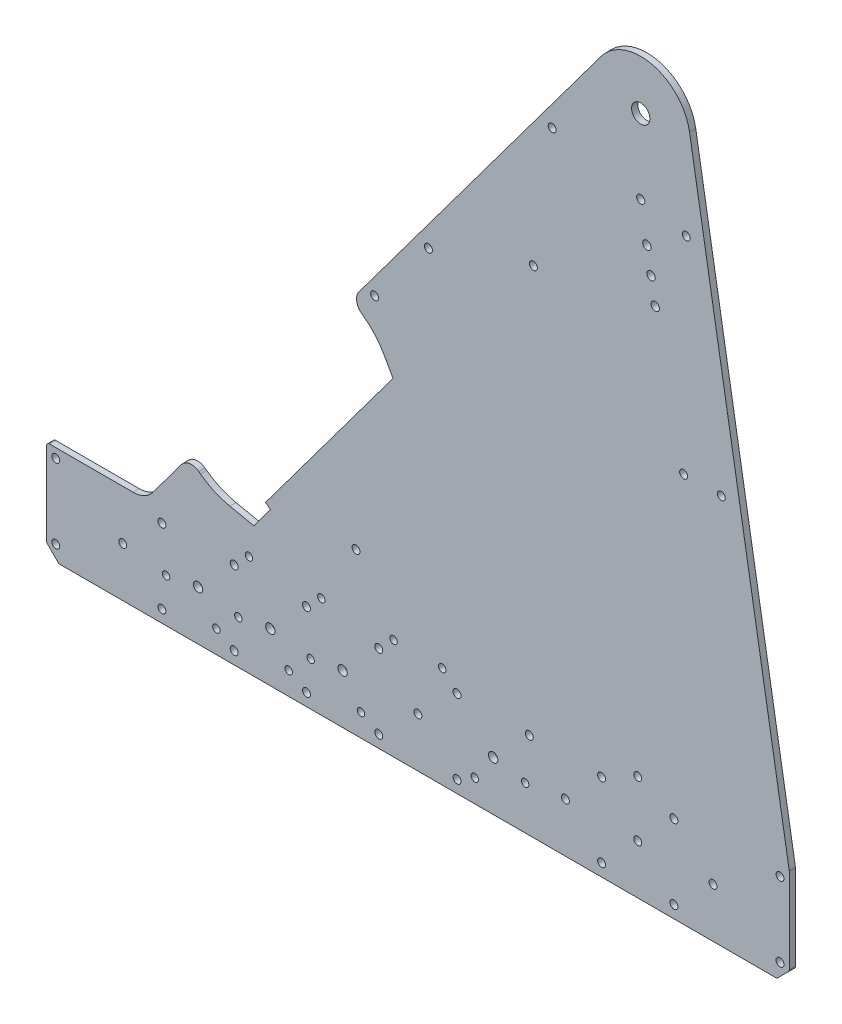
from build123d import *

# Parameters (mm, degrees)
BOSS_EXTRUDE1_DEPTH = 3.175
CUT_EXTRUDE1_REACH  = 536.354
SKETCH2_R           = 2.032
SKETCH5_R           = 2.032
SKETCH5_R_2         = 2.38125
CUT_EXTRUDE4_DEPTH  = 535.353537581
SKETCH6_R           = 2.032
CUT_EXTRUDE5_DEPTH  = 535.353537581
SKETCH3_R           = 4.699
SKETCH3_R_2         = 2.032
SKETCH3_R_3         = 2.0955
SKETCH3_R_4         = 2.159
CUT_EXTRUDE2_DEPTH  = 535.353537581
FILLET1_R           = 1.5875
CUT_EXTRUDE3_REACH  = 536.354
SKETCH4_R           = 1.905
FILLET2_R           = 38.1
FILLET3_R           = 6.35


with BuildPart() as part:
    # Sketch1 → Boss-Extrude1 (new body)
    with BuildSketch(Plane.XY):
        with BuildLine():
            Line((0, 0), (381, 0))
            Line((381, 0), (381, 50.8))
            Line((381, 50.8), (329.844840527, 353.482725241))
            ThreePointArc((329.844840527, 353.482725241), (310.749161823, 373.943470262), (284.430621647, 364.423939024))
            Line((284.430621647, 364.423939024), (156.481664632, 192.666249))
            Line((156.481664632, 192.666249), (169.212526103, 183.18253711))
            Line((169.212526103, 183.18253711), (177.742147454, 168.059112986))
            Line((177.742147454, 168.059112986), (112.328856621, 80.248817439))
            Line((112.328856621, 80.248817439), (114.875028915, 78.352075061))
            Line((114.875028915, 78.352075061), (106.339688214, 66.894299738))
            Line((106.339688214, 66.894299738), (85.755861471, 71.150956167))
            Line((85.755861471, 71.150956167), (73.025, 80.634668057))
            Line((73.025, 80.634668057), (54.608894484, 55.913030488))
            ThreePointArc((54.608894484, 55.913030488), (50.122252657, 52.150010731), (44.424205307, 50.8))
            Line((44.424205307, 50.8), (0, 50.8))
            Line((0, 50.8), (0, 0))
        make_face()
    extrude(amount=BOSS_EXTRUDE1_DEPTH)

    # Sketch2 → Cut-Extrude1 (cut, up to next)
    with BuildSketch(Plane.XY.offset(3.175), mode=Mode.PRIVATE) as cut_extrude1_sk1:
        with Locations((4.7625, 46.0375)):
            Circle(SKETCH2_R)
    cut_extrude1_tool1 = extrude(cut_extrude1_sk1.sketch, amount=-CUT_EXTRUDE1_REACH, mode=Mode.PRIVATE) & part.part
    # Sketch2 → Cut-Extrude1 (cut, up to next)
    with BuildSketch(Plane.XY.offset(3.175), mode=Mode.PRIVATE) as cut_extrude1_sk2:
        with Locations((4.7625, 7.9375)):
            Circle(SKETCH2_R)
    cut_extrude1_tool2 = extrude(cut_extrude1_sk2.sketch, amount=-CUT_EXTRUDE1_REACH, mode=Mode.PRIVATE) & part.part
    # Sketch2 → Cut-Extrude1 (cut, up to next)
    with BuildSketch(Plane.XY.offset(3.175), mode=Mode.PRIVATE) as cut_extrude1_sk3:
        with Locations((376.2375, 7.9375)):
            Circle(SKETCH2_R)
    cut_extrude1_tool3 = extrude(cut_extrude1_sk3.sketch, amount=-CUT_EXTRUDE1_REACH, mode=Mode.PRIVATE) & part.part
    # Sketch2 → Cut-Extrude1 (cut, up to next)
    with BuildSketch(Plane.XY.offset(3.175), mode=Mode.PRIVATE) as cut_extrude1_sk4:
        with Locations((376.2375, 46.0375)):
            Circle(SKETCH2_R)
    cut_extrude1_tool4 = extrude(cut_extrude1_sk4.sketch, amount=-CUT_EXTRUDE1_REACH, mode=Mode.PRIVATE) & part.part
    # Sketch2 → Cut-Extrude1 (cut, up to next)
    with BuildSketch(Plane.XY.offset(3.175), mode=Mode.PRIVATE) as cut_extrude1_sk5:
        Polygon((0, 6.35), (0, 0), (6.35, 0), align=None)
    cut_extrude1_tool5 = extrude(cut_extrude1_sk5.sketch, amount=-CUT_EXTRUDE1_REACH, mode=Mode.PRIVATE) & part.part
    # Sketch2 → Cut-Extrude1 (cut, up to next)
    with BuildSketch(Plane.XY.offset(3.175), mode=Mode.PRIVATE) as cut_extrude1_sk6:
        Polygon((381, 0), (374.65, 0), (381, 6.35), align=None)
    cut_extrude1_tool6 = extrude(cut_extrude1_sk6.sketch, amount=-CUT_EXTRUDE1_REACH, mode=Mode.PRIVATE) & part.part
    add(cut_extrude1_tool1.solids().sort_by_distance((4.7625, 46.0375, 3.175))[0], mode=Mode.SUBTRACT)
    add(cut_extrude1_tool2.solids().sort_by_distance((4.7625, 7.9375, 3.175))[0], mode=Mode.SUBTRACT)
    add(cut_extrude1_tool3.solids().sort_by_distance((376.2375, 7.9375, 3.175))[0], mode=Mode.SUBTRACT)
    add(cut_extrude1_tool4.solids().sort_by_distance((376.2375, 46.0375, 3.175))[0], mode=Mode.SUBTRACT)
    add(cut_extrude1_tool5.solids().sort_by_distance((2.116667, 2.116667, 3.175))[0], mode=Mode.SUBTRACT)
    add(cut_extrude1_tool6.solids().sort_by_distance((378.883333, 2.116667, 3.175))[0], mode=Mode.SUBTRACT)

    # Sketch5 → Cut-Extrude4 (cut, through all)
    with BuildSketch(Plane.XY.offset(3.175)):
        with Locations((39.116, 25.4)):
            Circle(SKETCH5_R)
        with Locations((59.182, 6.35)):
            Circle(SKETCH5_R)
        with Locations((59.182, 44.45)):
            Circle(SKETCH5_R)
        with Locations((96.266, 44.45)):
            Circle(SKETCH5_R)
        with Locations((133.35, 44.45)):
            Circle(SKETCH5_R)
        with Locations((170.434, 44.45)):
            Circle(SKETCH5_R)
        with Locations((210.566, 44.45)):
            Circle(SKETCH5_R)
        with Locations((210.566, 6.35)):
            Circle(SKETCH5_R)
        with Locations((170.434, 6.35)):
            Circle(SKETCH5_R)
        with Locations((247.65, 44.45)):
            Circle(SKETCH5_R)
        with Locations((266.192, 25.4)):
            Circle(SKETCH5_R)
        with Locations((77.724, 25.4)):
            Circle(SKETCH5_R_2)
        with Locations((114.808, 25.4)):
            Circle(SKETCH5_R_2)
        with Locations((151.892, 25.4)):
            Circle(SKETCH5_R_2)
        with Locations((229.108, 25.4)):
            Circle(SKETCH5_R_2)
        with Locations((190.5, 25.4)):
            Circle(SKETCH5_R)
        with Locations((303.276, 25.4)):
            Circle(SKETCH5_R)
        with Locations((341.884, 25.4)):
            Circle(SKETCH5_R)
    extrude(amount=-CUT_EXTRUDE4_DEPTH, mode=Mode.SUBTRACT)

    # Sketch6 → Cut-Extrude5 (cut, through all)
    with BuildSketch(Plane.XY.offset(3.175)):
        with Locations((284.734, 44.45)):
            Circle(SKETCH6_R)
        with Locations((284.734, 6.35)):
            Circle(SKETCH6_R)
        with Locations((321.818, 6.35)):
            Circle(SKETCH6_R)
        with Locations((321.818, 44.45)):
            Circle(SKETCH6_R)
        with Locations((96.266, 6.35)):
            Circle(SKETCH6_R)
        with Locations((133.35, 6.35)):
            Circle(SKETCH6_R)
        with Locations((303.276, 53.975)):
            Circle(SKETCH6_R)
    extrude(amount=-CUT_EXTRUDE5_DEPTH, mode=Mode.SUBTRACT)

    # Sketch3 → Cut-Extrude2 (cut, through all)
    with BuildSketch(Plane.XY.offset(3.175)):
        with Locations((304.8, 349.25)):
            Circle(SKETCH3_R)
        with Locations((168.275, 200.025)):
            Circle(SKETCH3_R_2)
        with Locations((158.75, 82.55)):
            Circle(SKETCH3_R_2)
        with Locations((304.8, 311.15)):
            Circle(SKETCH3_R_3)
        with Locations((307.974543931, 292.366369605)):
            Circle(SKETCH3_R_4)
        with Locations((310.090906551, 279.843949341)):
            Circle(SKETCH3_R_4)
        with Locations((312.207269172, 267.321529077)):
            Circle(SKETCH3_R_4)
        with Locations((328.130942222, 306.465572241)):
            Circle(SKETCH3_R_2)
        with Locations((346.120024496, 200.025)):
            Circle(SKETCH3_R_2)
        with Locations((195.89872712, 234.95)):
            Circle(SKETCH3_R_2)
        with Locations((249.748290579, 254.09019371)):
            Circle(SKETCH3_R_2)
        with Locations((259.353431816, 320.131104669)):
            Circle(SKETCH3_R_2)
        with Locations((326.799877519, 200.025)):
            Circle(SKETCH3_R_2)
    extrude(amount=-CUT_EXTRUDE2_DEPTH, mode=Mode.SUBTRACT)

    # Fillet1
    fillet1_edges = [part.edges().sort_by_distance(p)[0] for p in [
        (374.65, 0, 1.5875),
        (381, 6.35, 1.5875),
        (381, 50.8, 1.5875),
        (6.35, 0, 1.5875),
        (0, 6.35, 1.5875),
        (0, 50.8, 1.5875),
    ]]
    fillet(fillet1_edges, radius=FILLET1_R)

    # Sketch4 → Cut-Extrude3 (cut, up to next)
    with BuildSketch(Plane(origin=(0, 0, 0), x_dir=(-1, 0, 0), z_dir=(0, 0, -1)), mode=Mode.PRIVATE) as cut_extrude3_sk1:
        with Locations((-61.318145625, 22.298133105)):
            Circle(SKETCH4_R)
    cut_extrude3_tool1 = extrude(cut_extrude3_sk1.sketch, amount=-CUT_EXTRUDE3_REACH, mode=Mode.PRIVATE) & part.part
    # Sketch4 → Cut-Extrude3 (cut, up to next)
    with BuildSketch(Plane(origin=(0, 0, 0), x_dir=(-1, 0, 0), z_dir=(0, 0, -1)), mode=Mode.PRIVATE) as cut_extrude3_sk2:
        with Locations((-87.131339764, 11.605958005)):
            Circle(SKETCH4_R)
    cut_extrude3_tool2 = extrude(cut_extrude3_sk2.sketch, amount=-CUT_EXTRUDE3_REACH, mode=Mode.PRIVATE) & part.part
    # Sketch4 → Cut-Extrude3 (cut, up to next)
    with BuildSketch(Plane(origin=(0, 0, 0), x_dir=(-1, 0, 0), z_dir=(0, 0, -1)), mode=Mode.PRIVATE) as cut_extrude3_sk3:
        with Locations((-98.402145625, 22.298133105)):
            Circle(SKETCH4_R)
    cut_extrude3_tool3 = extrude(cut_extrude3_sk3.sketch, amount=-CUT_EXTRUDE3_REACH, mode=Mode.PRIVATE) & part.part
    # Sketch4 → Cut-Extrude3 (cut, up to next)
    with BuildSketch(Plane(origin=(0, 0, 0), x_dir=(-1, 0, 0), z_dir=(0, 0, -1)), mode=Mode.PRIVATE) as cut_extrude3_sk4:
        with Locations((-124.215339764, 11.605958005)):
            Circle(SKETCH4_R)
    cut_extrude3_tool4 = extrude(cut_extrude3_sk4.sketch, amount=-CUT_EXTRUDE3_REACH, mode=Mode.PRIVATE) & part.part
    # Sketch4 → Cut-Extrude3 (cut, up to next)
    with BuildSketch(Plane(origin=(0, 0, 0), x_dir=(-1, 0, 0), z_dir=(0, 0, -1)), mode=Mode.PRIVATE) as cut_extrude3_sk5:
        with Locations((-135.486145625, 22.298133105)):
            Circle(SKETCH4_R)
    cut_extrude3_tool5 = extrude(cut_extrude3_sk5.sketch, amount=-CUT_EXTRUDE3_REACH, mode=Mode.PRIVATE) & part.part
    # Sketch4 → Cut-Extrude3 (cut, up to next)
    with BuildSketch(Plane(origin=(0, 0, 0), x_dir=(-1, 0, 0), z_dir=(0, 0, -1)), mode=Mode.PRIVATE) as cut_extrude3_sk6:
        with Locations((-161.299339764, 11.605958005)):
            Circle(SKETCH4_R)
    cut_extrude3_tool6 = extrude(cut_extrude3_sk6.sketch, amount=-CUT_EXTRUDE3_REACH, mode=Mode.PRIVATE) & part.part
    # Sketch4 → Cut-Extrude3 (cut, up to next)
    with BuildSketch(Plane(origin=(0, 0, 0), x_dir=(-1, 0, 0), z_dir=(0, 0, -1)), mode=Mode.PRIVATE) as cut_extrude3_sk7:
        with Locations((-245.513854375, 22.298133105)):
            Circle(SKETCH4_R)
    cut_extrude3_tool7 = extrude(cut_extrude3_sk7.sketch, amount=-CUT_EXTRUDE3_REACH, mode=Mode.PRIVATE) & part.part
    # Sketch4 → Cut-Extrude3 (cut, up to next)
    with BuildSketch(Plane(origin=(0, 0, 0), x_dir=(-1, 0, 0), z_dir=(0, 0, -1)), mode=Mode.PRIVATE) as cut_extrude3_sk8:
        with Locations((-219.700660236, 11.605958005)):
            Circle(SKETCH4_R)
    cut_extrude3_tool8 = extrude(cut_extrude3_sk8.sketch, amount=-CUT_EXTRUDE3_REACH, mode=Mode.PRIVATE) & part.part
    # Sketch4 → Cut-Extrude3 (cut, up to next)
    with BuildSketch(Plane(origin=(0, 0, 0), x_dir=(-1, 0, 0), z_dir=(0, 0, -1)), mode=Mode.PRIVATE) as cut_extrude3_sk9:
        with Locations((-202.981986443, 51.968407021)):
            Circle(SKETCH4_R)
    cut_extrude3_tool9 = extrude(cut_extrude3_sk9.sketch, amount=-CUT_EXTRUDE3_REACH, mode=Mode.PRIVATE) & part.part
    # Sketch4 → Cut-Extrude3 (cut, up to next)
    with BuildSketch(Plane(origin=(0, 0, 0), x_dir=(-1, 0, 0), z_dir=(0, 0, -1)), mode=Mode.PRIVATE) as cut_extrude3_sk10:
        with Locations((-178.018013557, 51.968407021)):
            Circle(SKETCH4_R)
    cut_extrude3_tool10 = extrude(cut_extrude3_sk10.sketch, amount=-CUT_EXTRUDE3_REACH, mode=Mode.PRIVATE) & part.part
    # Sketch4 → Cut-Extrude3 (cut, up to next)
    with BuildSketch(Plane(origin=(0, 0, 0), x_dir=(-1, 0, 0), z_dir=(0, 0, -1)), mode=Mode.PRIVATE) as cut_extrude3_sk11:
        with Locations((-140.934013557, 51.968407021)):
            Circle(SKETCH4_R)
    cut_extrude3_tool11 = extrude(cut_extrude3_sk11.sketch, amount=-CUT_EXTRUDE3_REACH, mode=Mode.PRIVATE) & part.part
    # Sketch4 → Cut-Extrude3 (cut, up to next)
    with BuildSketch(Plane(origin=(0, 0, 0), x_dir=(-1, 0, 0), z_dir=(0, 0, -1)), mode=Mode.PRIVATE) as cut_extrude3_sk12:
        with Locations((-103.850013557, 51.968407021)):
            Circle(SKETCH4_R)
    cut_extrude3_tool12 = extrude(cut_extrude3_sk12.sketch, amount=-CUT_EXTRUDE3_REACH, mode=Mode.PRIVATE) & part.part
    add(cut_extrude3_tool1.solids().sort_by_distance((61.318146, 22.298133, 0))[0], mode=Mode.SUBTRACT)
    add(cut_extrude3_tool2.solids().sort_by_distance((87.13134, 11.605958, 0))[0], mode=Mode.SUBTRACT)
    add(cut_extrude3_tool3.solids().sort_by_distance((98.402146, 22.298133, 0))[0], mode=Mode.SUBTRACT)
    add(cut_extrude3_tool4.solids().sort_by_distance((124.21534, 11.605958, 0))[0], mode=Mode.SUBTRACT)
    add(cut_extrude3_tool5.solids().sort_by_distance((135.486146, 22.298133, 0))[0], mode=Mode.SUBTRACT)
    add(cut_extrude3_tool6.solids().sort_by_distance((161.29934, 11.605958, 0))[0], mode=Mode.SUBTRACT)
    add(cut_extrude3_tool7.solids().sort_by_distance((245.513854, 22.298133, 0))[0], mode=Mode.SUBTRACT)
    add(cut_extrude3_tool8.solids().sort_by_distance((219.70066, 11.605958, 0))[0], mode=Mode.SUBTRACT)
    add(cut_extrude3_tool9.solids().sort_by_distance((202.981986, 51.968407, 0))[0], mode=Mode.SUBTRACT)
    add(cut_extrude3_tool10.solids().sort_by_distance((178.018014, 51.968407, 0))[0], mode=Mode.SUBTRACT)
    add(cut_extrude3_tool11.solids().sort_by_distance((140.934014, 51.968407, 0))[0], mode=Mode.SUBTRACT)
    add(cut_extrude3_tool12.solids().sort_by_distance((103.850014, 51.968407, 0))[0], mode=Mode.SUBTRACT)

    # Fillet2
    fillet2_edges = [part.edges().sort_by_distance(p)[0] for p in [
        (85.755861471, 71.150956167, 1.5875),
        (169.212526103, 183.18253711, 1.5875),
    ]]
    fillet(fillet2_edges, radius=FILLET2_R)

    # Fillet3
    fillet3_edges = [part.edges().sort_by_distance(p)[0] for p in [
        (73.025, 80.634668057, 1.5875),
        (156.481664632, 192.666249, 1.5875),
    ]]
    fillet(fillet3_edges, radius=FILLET3_R)


solid = part.part
